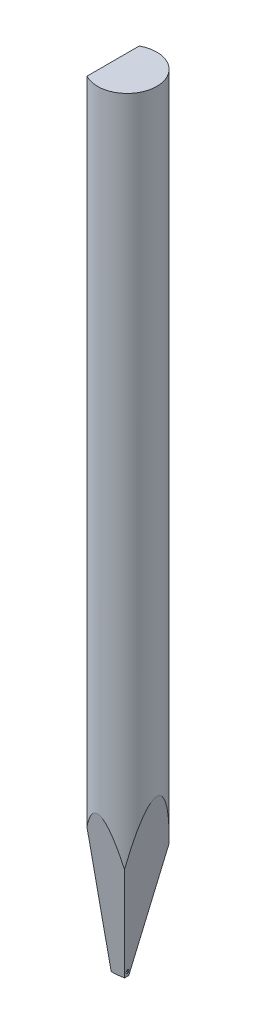
from build123d import *

# Parameters (mm, degrees)
TD_SKETCH_R                             = 0.79248
TL_FEATURE_DEPTH                        = 21.0312
TDF_STD_SKETCH_W                        = 2.09296
TDF_STD_SKETCH_H                        = 2.09296
TDF_STD_FEATURE_DEPTH                   = 22.061040395
ISA_20_STD_FEATURE_DEPTH                = 22.061040395
ISA_20_STD_FEATURE_DEPTH_BACK           = 22.061040395
F_10BA_STD_FEATURE_DEPTH                = 22.061040395
F_10BA_STD_FEATURE_DEPTH_BACK           = 22.061040395
FRO_STD_FEATURE_DEPTH                   = 22.061040395
FRO_STD_FEATURE_DEPTH_BACK              = 22.061040395
C_STD_FEATURE_DEPTH                     = 22.061040395
C_STD_FEATURE_DEPTH_BACK                = 22.061040395
ERW_STD_FEATURE_DEPTH                   = 0.0254
H_STD_FEATURE_REACH                     = 22.922
H_STD_SKETCH_R                          = 0.02286
H_STD_SKETCH_3_R                        = 0.02286
FUNNEL_FINAL_DIAMETRE_STD_FEATURE_DEPTH = 2.499995
FUNNEL_FINAL_DIAMETRE_STD_FEATURE_DRAFT = -22.5
ROUND_BR_STD_FEATURE_START              = -1
ROUND_BR_STD_FEATURE_DEPTH              = 0.96499722


with BuildPart() as part:
    # TD_sketch → TL_feature (new body)
    with BuildSketch(Plane(origin=(0, 0, 0), x_dir=(1, 0, 0), z_dir=(0, 1, 0))):
        with Locations(Location((0, 0, 0), (0, 0, 270))):
            Circle(TD_SKETCH_R)
    extrude(amount=TL_FEATURE_DEPTH)

    # TDF_STD_sketch → TDF_STD_feature (cut, through all)
    with BuildSketch(Plane(origin=(0, 0, 0), x_dir=(1, 0, 0), z_dir=(0, 1, 0))):
        with Locations((-1.4224, 0)):
            Rectangle(TDF_STD_SKETCH_W, TDF_STD_SKETCH_H)
    extrude(amount=TDF_STD_FEATURE_DEPTH, mode=Mode.SUBTRACT)

    # ISA_20_STD_sketch → ISA_20_STD_feature (cut, two sides: drawn at the far end of the back side and taken through both)
    with BuildSketch(Plane(origin=(0, 0, 0), x_dir=(0, 0, -1), z_dir=(1, 0, 0)).offset(-ISA_20_STD_FEATURE_DEPTH_BACK)):
        Polygon((-12.968809457, 73.261672178), (-3.759167997, 21.0312), (-0.0508, 0), (0.0508, 0), (3.759167997, 21.0312), (12.968809457, 73.261672178), (12.968809457, -32.810750623), (-12.968809457, -32.810750623), align=None)
    extrude(amount=ISA_20_STD_FEATURE_DEPTH + ISA_20_STD_FEATURE_DEPTH_BACK, mode=Mode.SUBTRACT)

    # 10BA_STD_sketch → 10BA_STD_feature (cut, two sides: drawn at the far end of the back side and taken through both)
    with BuildSketch(Plane.XY.offset(-F_10BA_STD_FEATURE_DEPTH_BACK)):
        Polygon((-53.216424634, 0), (-0.37592, 0), (-0.27432, 0), (-0.013865644, 0.036604473), (3.688047997, 21.0312), (12.863705333, 73.068938636), (91.245889802, 2.18375769), (25.165759835, -70.885180946), align=None)
    extrude(amount=F_10BA_STD_FEATURE_DEPTH + F_10BA_STD_FEATURE_DEPTH_BACK, mode=Mode.SUBTRACT)

    # FRO_STD_sketch → FRO_STD_feature (cut, two sides: drawn at the far end of the back side and taken through both)
    with BuildSketch(Plane.XY.offset(-FRO_STD_FEATURE_DEPTH_BACK)):
        with BuildLine():
            Line((-0.37592, 52.149873762), (-0.37592, 0.0254))
            ThreePointArc((-0.37592, 0.0254), (-0.368480512, 0.007439488), (-0.35052, 0))
            Line((-0.35052, 0), (51.773953762, 0))
            Line((51.773953762, 0), (-21.941183964, -73.715137726))
            Line((-21.941183964, -73.715137726), (-74.091057726, -21.565263964))
            Line((-74.091057726, -21.565263964), (-0.37592, 52.149873762))
        make_face()
    extrude(amount=FRO_STD_FEATURE_DEPTH + FRO_STD_FEATURE_DEPTH_BACK, mode=Mode.SUBTRACT)

    # C_STD_sketch → C_STD_feature (cut, two sides: drawn at the far end of the back side and taken through both)
    with BuildSketch(Plane(origin=(0, 0, 0), x_dir=(0, 0, -1), z_dir=(1, 0, 0)).offset(-C_STD_FEATURE_DEPTH_BACK)):
        with BuildLine():
            Line((-51.498419713, -8.177529753), (-0.048243287, 0))
            ThreePointArc((-0.048243287, 0), (0, 0.00381), (0.048243287, 0))
            Line((0.048243287, 0), (51.498419713, -8.177529753))
            Line((51.498419713, -8.177529753), (51.498419713, -112.369518834))
            Line((51.498419713, -112.369518834), (-51.498419713, -112.369518834))
            Line((-51.498419713, -112.369518834), (-51.498419713, -8.177529753))
        make_face()
    extrude(amount=C_STD_FEATURE_DEPTH + C_STD_FEATURE_DEPTH_BACK, mode=Mode.SUBTRACT)


with BuildPart() as body_2:
    # ERW_STD_sketch → ERW_STD_feature (new, symmetric)
    with BuildSketch(Plane.XY):
        Polygon((-0.145800064, 0.06604), (-0.145800064, 0), (-0.310900064, 0), (-0.261135355, 0.06604), align=None)
    extrude(amount=ERW_STD_FEATURE_DEPTH, both=True)

    # H_STD_sketch → H_STD_feature (add, up to next)
    with BuildSketch(Plane(origin=(-0.017961309, 0.13984774, 0), x_dir=(0, 0, -1), z_dir=(0.8660254037844415, 0.4999999999999953, 0)), mode=Mode.PRIVATE) as h_std_feature_sk1:
        with Locations(Location((0, 0, 0), (0, 0, 90))):
            Circle(H_STD_SKETCH_R)
    h_std_feature_tool1 = extrude(h_std_feature_sk1.sketch, amount=-H_STD_FEATURE_REACH, mode=Mode.PRIVATE) - body_2.part
    add(h_std_feature_tool1.solids().sort_by_distance((-0.017961, 0.139848, 0))[0])


with BuildPart() as funnel_final_diametre_std_feature_tool:
    # H_STD_sketch<3> → funnel_final_diametre_STD_feature (with draft: the straight prism first)
    with BuildSketch(Plane(origin=(-0.017961309, 0.13984774, 0), x_dir=(0, 0, -1), z_dir=(0.8660254037844415, 0.4999999999999953, 0))):
        with Locations(Location((0, 0, 0), (0, 0, 90))):
            Circle(H_STD_SKETCH_3_R)
    extrude(amount=FUNNEL_FINAL_DIAMETRE_STD_FEATURE_DEPTH)
    # funnel_final_diametre_STD_feature: the draft: its side faces are tilted about the plane it starts from
    funnel_final_diametre_std_feature_sides = [funnel_final_diametre_std_feature_tool.faces().sort_by_distance(p)[0] for p in [
        (1.075998281, 0.745049149, 0),
    ]]
    draft(funnel_final_diametre_std_feature_sides, Plane(origin=(-0.017961309, 0.13984774, 0), x_dir=(0, 0, -1), z_dir=(0.8660254037844415, 0.4999999999999953, 0)), FUNNEL_FINAL_DIAMETRE_STD_FEATURE_DRAFT)


with BuildPart() as body_2_1:
    add(body_2.part)

    # funnel_final_diametre_STD_feature: add funnel_final_diametre_std_feature_tool
    add(funnel_final_diametre_std_feature_tool.part)

    # ROUND_BR_STD_feature: read off the stored shape, not the designer's step
    # ROUND_BR_STD_feature outline → ROUND_BR_STD_feature (cut)
    with BuildSketch(Plane(origin=(0, 0, 0), x_dir=(0.79863551004729, -0.601815023152052, 0), z_dir=(0.601815023152052, 0.79863551004729, 0)).offset(ROUND_BR_STD_FEATURE_START)):
        with BuildLine():
            Line((-0.248295831, -0.0254), (-0.222895831, -0.0254))
            ThreePointArc((-0.222895831, -0.0254), (-0.240856343, -0.017960512), (-0.248295831, 0))
            Line((-0.248295831, 0), (-0.248295831, -0.0254))
        make_face()
        with BuildLine():
            Line((-0.248295831, 0.0254), (-0.248295831, 0))
            ThreePointArc((-0.248295831, 0), (-0.240856343, 0.017960512), (-0.222895831, 0.0254))
            Line((-0.222895831, 0.0254), (-0.248295831, 0.0254))
        make_face()
    extrude(amount=ROUND_BR_STD_FEATURE_DEPTH, mode=Mode.SUBTRACT)


with BuildPart() as part_1:
    add(part.part)

    # COMBINE_STD_feature: cut body 2
    add(body_2_1.part, mode=Mode.SUBTRACT)


solid = part_1.part
